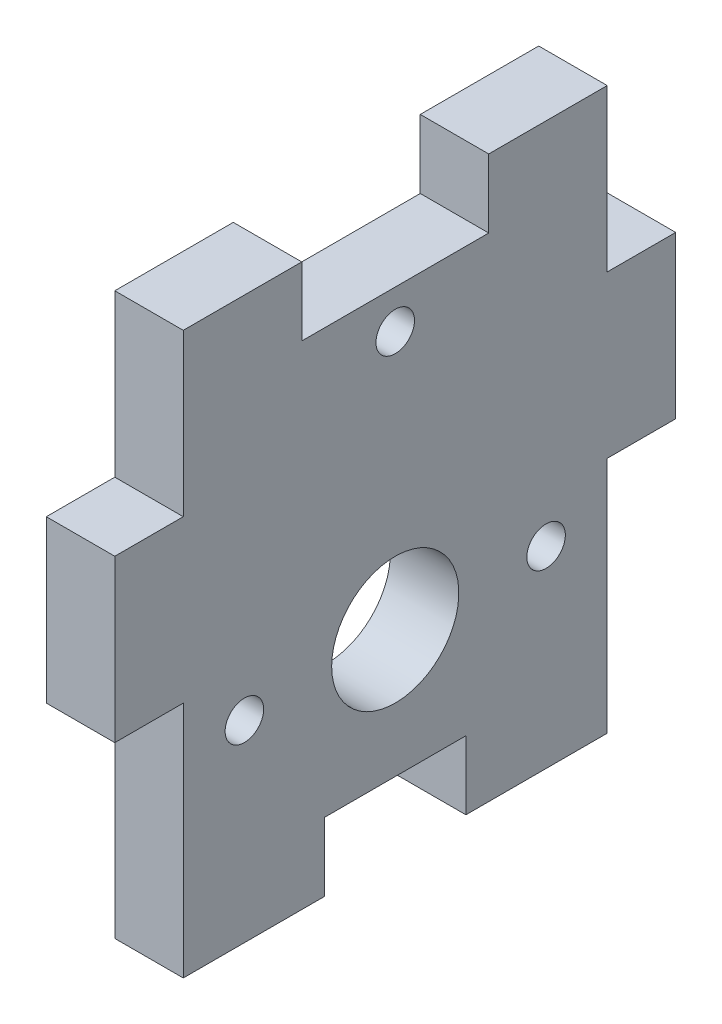
from build123d import *

# Parameters (mm, degrees)
SKETCH2_W             = 33.02
SKETCH2_H             = 33.02
BOSS_EXTRUDE2_DEPTH   = 5.334
SKETCH3_W             = 33.02
SKETCH3_H             = 5.334
BOSS_EXTRUDE6_DEPTH   = 5.334
SKETCH6_W             = 11.006666666
SKETCH6_H             = 5.334
CUT_EXTRUDE2_DEPTH    = 32.349198203
CAVITY2_START         = -21.844
CAVITY2_OUTLINE_W     = 5.334
CAVITY2_OUTLINE_H     = 13.208
CAVITY2_OUTLINE_H_2   = 12.573
CAVITY2_DEPTH         = 5.334
CAVITY2_START_2       = 16.51
CAVITY2_2_OUTLINE_W   = 5.334
CAVITY2_2_OUTLINE_H   = 13.208
CAVITY2_2_OUTLINE_H_2 = 12.573
CAVITY2_2_DEPTH       = 5.334
CAVITY2_START_3       = -7.281333333
CAVITY2_3_OUTLINE_W   = 5.334
CAVITY2_3_OUTLINE_H   = 5.334
CAVITY2_3_DEPTH       = 14.562666666
SKETCH7_R             = 1.5
SKETCH7_R_2           = 4.953
CUT_EXTRUDE3_DEPTH    = 32.349198203


# Read off the part's stored shape, not the designer's step: Cavity2
with BuildPart() as part:
    # Sketch2 → Boss-Extrude2 (new body)
    with BuildSketch(Plane(origin=(0, 0, 0), x_dir=(0, 0, -1), z_dir=(1, 0, 0))):
        Rectangle(SKETCH2_W, SKETCH2_H)
    extrude(amount=BOSS_EXTRUDE2_DEPTH)

    # Sketch3 → Boss-Extrude6 (add, through all)
    with BuildSketch(Plane(origin=(5.334, 0, 0), x_dir=(0, 0, -1), z_dir=(1, 0, 0))):
        Polygon((-16.51, 16.51), (-16.51, 21.844), (-21.844, 21.844), (-21.844, -16.51), (-16.51, -16.51), align=None)
        with Locations((0, 19.177)):
            Rectangle(SKETCH3_W, SKETCH3_H)
        Polygon((21.844, 21.844), (21.844, -16.51), (16.51, -16.51), (16.51, 16.51), (16.51, 21.844), align=None)
        with Locations((0, -19.177)):
            Rectangle(SKETCH3_W, SKETCH3_H)
    extrude(amount=-BOSS_EXTRUDE6_DEPTH)

    # Sketch6 → Cut-Extrude2 (cut, through all)
    with BuildSketch(Plane(origin=(5.334, 0, 0), x_dir=(0, 0, -1), z_dir=(1, 0, 0))):
        with Locations((0, -19.177)):
            Rectangle(SKETCH6_W, SKETCH6_H)
    extrude(amount=-CUT_EXTRUDE2_DEPTH, mode=Mode.SUBTRACT)

    # Cavity2 outline → Cavity2 (cut)
    with BuildSketch(Plane.XY.offset(CAVITY2_START)):
        with Locations((2.667, -9.906)):
            Rectangle(CAVITY2_OUTLINE_W, CAVITY2_OUTLINE_H)
        with Locations((2.667, 15.5575)):
            Rectangle(CAVITY2_OUTLINE_W, CAVITY2_OUTLINE_H_2)
    extrude(amount=CAVITY2_DEPTH, mode=Mode.SUBTRACT)

    # Cavity2 2 outline → Cavity2 2 (cut)
    with BuildSketch(Plane.XY.offset(CAVITY2_START_2)):
        with Locations((2.667, -9.906)):
            Rectangle(CAVITY2_2_OUTLINE_W, CAVITY2_2_OUTLINE_H)
        with Locations((2.667, 15.5575)):
            Rectangle(CAVITY2_2_OUTLINE_W, CAVITY2_2_OUTLINE_H_2)
    extrude(amount=CAVITY2_2_DEPTH, mode=Mode.SUBTRACT)

    # Cavity2 3 outline → Cavity2 3 (cut)
    with BuildSketch(Plane.XY.offset(CAVITY2_START_3)):
        with Locations((2.667, 19.177)):
            Rectangle(CAVITY2_3_OUTLINE_W, CAVITY2_3_OUTLINE_H)
    extrude(amount=CAVITY2_3_DEPTH, mode=Mode.SUBTRACT)

    # Sketch7 → Cut-Extrude3 (cut, through all)
    with BuildSketch(Plane.ZY):
        with Locations((0, 13.51)):
            Circle(SKETCH7_R)
        with Locations((11.75, -6.841596989)):
            Circle(SKETCH7_R)
        with Locations((0, -6.604)):
            Circle(SKETCH7_R_2)
        with Locations((-11.75, -6.841596989)):
            Circle(SKETCH7_R)
    extrude(amount=-CUT_EXTRUDE3_DEPTH, mode=Mode.SUBTRACT)


solid = part.part
